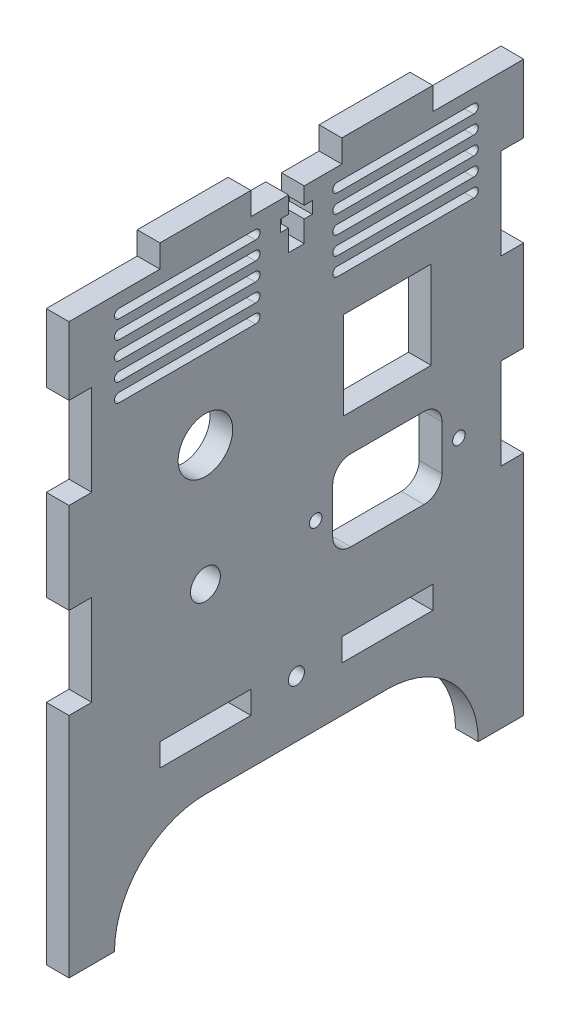
from build123d import *

# Parameters (mm, degrees)
SKETCH1_W                 = 127
SKETCH1_H                 = 165.1
BOSS_EXTRUDE1_DEPTH       = 6.35
SKETCH2_W                 = 25.4
SKETCH2_H                 = 6.35
CUT_EXTRUDE1_DEPTH        = 6.35
LPATTERN1_COUNT           = 3
LPATTERN1_PITCH           = 50.8
CUT_EXTRUDE4_DEPTH        = 6.35
SKETCH8_W                 = 6.35
SKETCH8_H                 = 25.4
CUT_EXTRUDE6_DEPTH        = 6.35
LPATTERN4_COUNT           = 2
LPATTERN4_PITCH           = 50.8
MIRROR1_COPY_1_SKETCH_W   = 6.35
MIRROR1_COPY_1_SKETCH_H   = 25.4
MIRROR1_COPY_1_DEPTH      = 6.35
MIRROR1_COPY_2_SKETCH_W   = 6.35
MIRROR1_COPY_2_SKETCH_H   = 25.4
MIRROR1_COPY_2_DEPTH      = 6.35
SKETCH9_W                 = 25.4
SKETCH9_H                 = 6.35
CUT_EXTRUDE7_DEPTH        = 6.35
LPATTERN6_COUNT           = 2
LPATTERN6_PITCH           = 50.8
SKETCH16_W                = 4.3942
SKETCH16_H                = 13.97
SKETCH16_W_2              = 8.89
SKETCH16_H_2              = 3.302
CUT_EXTRUDE14_DEPTH       = 6.35
F_8_CLEARANCE_HOLE1_D     = 4.4958
F_8_CLEARANCE_HOLE1_DEPTH = 10.16
F_8_CLEARANCE_HOLE1_TIP   = 1.350674586
CUT_EXTRUDE15_DEPTH       = 6.35
LPATTERN7_COPY_1_DEPTH    = 6.35
LPATTERN7_COPY_2_DEPTH    = 6.35
LPATTERN7_COPY_3_DEPTH    = 6.35
LPATTERN7_COPY_4_DEPTH    = 6.35
LPATTERN7_COPY_5_DEPTH    = 6.35
LPATTERN7_COPY_6_DEPTH    = 6.35
LPATTERN7_COPY_7_DEPTH    = 6.35
LPATTERN7_COPY_8_DEPTH    = 6.35
SKETCH20_R                = 1.75
CUT_EXTRUDE16_DEPTH       = 7.62
SKETCH22_W                = 24.5
SKETCH22_H                = 24.5
CUT_EXTRUDE17_DEPTH       = 6.35
SKETCH23_R                = 7.62
CUT_EXTRUDE18_DEPTH       = 7.62
SKETCH24_R                = 4.1671875
CUT_EXTRUDE19_DEPTH       = 7.62


with BuildPart() as part:
    # Sketch1 → Boss-Extrude1 (new body)
    with BuildSketch(Plane(origin=(0, 0, 0), x_dir=(0, 0, -1), z_dir=(1, 0, 0))):
        Rectangle(SKETCH1_W, SKETCH1_H)
    extrude(amount=BOSS_EXTRUDE1_DEPTH)

    # Sketch2 → Cut-Extrude1 (cut)
    with BuildSketch(Plane(origin=(6.35, 0, 0), x_dir=(0, 0, -1), z_dir=(1, 0, 0))):
        with Locations((-50.8, 79.375)):
            Rectangle(SKETCH2_W, SKETCH2_H)
    cut_extrude1 = extrude(amount=-CUT_EXTRUDE1_DEPTH, mode=Mode.SUBTRACT)

    # LPattern1: Cut-Extrude1 ×3
    with Locations(*[(0, 0, -i * LPATTERN1_PITCH) for i in range(1, LPATTERN1_COUNT)]):
        add(cut_extrude1, mode=Mode.SUBTRACT)

    # Sketch5 → Cut-Extrude4 (cut)
    with BuildSketch(Plane(origin=(6.35, 0, 0), x_dir=(0, 0, -1), z_dir=(1, 0, 0))):
        with BuildLine():
            Line((-25.4, -57.15), (25.4, -57.15))
            ThreePointArc((25.4, -57.15), (50.8, -82.55), (25.4, -107.95))
            Line((25.4, -107.95), (-25.4, -107.95))
            ThreePointArc((-25.4, -107.95), (-50.8, -82.55), (-25.4, -57.15))
        make_face()
    extrude(amount=-CUT_EXTRUDE4_DEPTH, mode=Mode.SUBTRACT)

    # Sketch8 → Cut-Extrude6 (cut)
    with BuildSketch(Plane(origin=(6.35, 0, 0), x_dir=(0, 0, -1), z_dir=(1, 0, 0))):
        with Locations((60.325, 44.45)):
            Rectangle(SKETCH8_W, SKETCH8_H)
    cut_extrude6 = extrude(amount=-CUT_EXTRUDE6_DEPTH, mode=Mode.SUBTRACT)

    # LPattern4: Cut-Extrude6 ×2
    with Locations(*[(0, -i * LPATTERN4_PITCH, 0) for i in range(1, LPATTERN4_COUNT)]):
        add(cut_extrude6, mode=Mode.SUBTRACT)

    # Mirror1 copy 1 sketch → Mirror1 copy 1 (cut)
    with BuildSketch(Plane(origin=(6.35, -50.8, 0), x_dir=(0, 0, 1), z_dir=(1, 0, 0))):
        with Locations((60.325, -44.45)):
            Rectangle(MIRROR1_COPY_1_SKETCH_W, MIRROR1_COPY_1_SKETCH_H)
    extrude(amount=-MIRROR1_COPY_1_DEPTH, mode=Mode.SUBTRACT)

    # Mirror1 copy 2 sketch → Mirror1 copy 2 (cut)
    with BuildSketch(Plane(origin=(6.35, 0, 0), x_dir=(0, 0, 1), z_dir=(1, 0, 0))):
        with Locations((60.325, -44.45)):
            Rectangle(MIRROR1_COPY_2_SKETCH_W, MIRROR1_COPY_2_SKETCH_H)
    extrude(amount=-MIRROR1_COPY_2_DEPTH, mode=Mode.SUBTRACT)

    # Sketch9 → Cut-Extrude7 (cut)
    with BuildSketch(Plane.ZY):
        with Locations((-25.4, -41.275)):
            Rectangle(SKETCH9_W, SKETCH9_H)
    cut_extrude7 = extrude(amount=-CUT_EXTRUDE7_DEPTH, mode=Mode.SUBTRACT)

    # LPattern6: Cut-Extrude7 ×2
    with Locations(*[(0, 0, i * LPATTERN6_PITCH) for i in range(1, LPATTERN6_COUNT)]):
        add(cut_extrude7, mode=Mode.SUBTRACT)

    # Sketch16 → Cut-Extrude14 (cut)
    with BuildSketch(Plane.ZY):
        with Locations((0, 69.215)):
            Rectangle(SKETCH16_W, SKETCH16_H)
        with Locations((0, 69.85)):
            Rectangle(SKETCH16_W_2, SKETCH16_H_2)
    extrude(amount=-CUT_EXTRUDE14_DEPTH, mode=Mode.SUBTRACT)

    # #8 Clearance Hole1
    with Locations(Plane.ZY):
        with Locations((0, -41.275)):
            Hole(F_8_CLEARANCE_HOLE1_D / 2, depth=F_8_CLEARANCE_HOLE1_DEPTH)
            with Locations((0, 0, -(F_8_CLEARANCE_HOLE1_DEPTH + F_8_CLEARANCE_HOLE1_TIP / 2))):  # 118° drill point
                Cone(0, F_8_CLEARANCE_HOLE1_D / 2, F_8_CLEARANCE_HOLE1_TIP, mode=Mode.SUBTRACT)

    # Sketch19 → Cut-Extrude15 (cut)
    with BuildSketch(Plane.ZY):
        with BuildLine():
            Line((-49.53, 72.448860523), (-11.43, 72.448860523))
            ThreePointArc((-11.43, 72.448860523), (-10.16, 71.178860523), (-11.43, 69.908860523))
            Line((-11.43, 69.908860523), (-49.53, 69.908860523))
            ThreePointArc((-49.53, 69.908860523), (-50.8, 71.178860523), (-49.53, 72.448860523))
        make_face()
    cut_extrude15 = extrude(amount=-CUT_EXTRUDE15_DEPTH, mode=Mode.SUBTRACT)

    # Mirror2: Cut-Extrude15 across plane
    add(cut_extrude15.mirror(Plane.XY), mode=Mode.SUBTRACT)

    # LPattern7 copy 1 sketch → LPattern7 copy 1 (cut)
    with BuildSketch(Plane(origin=(0, -5.08, 0), x_dir=(0, 0, -1), z_dir=(-1, 0, 0))):
        with BuildLine():
            Line((-49.53, -72.448860523), (-11.43, -72.448860523))
            ThreePointArc((-11.43, -72.448860523), (-10.16, -71.178860523), (-11.43, -69.908860523))
            Line((-11.43, -69.908860523), (-49.53, -69.908860523))
            ThreePointArc((-49.53, -69.908860523), (-50.8, -71.178860523), (-49.53, -72.448860523))
        make_face()
    extrude(amount=-LPATTERN7_COPY_1_DEPTH, mode=Mode.SUBTRACT)

    # LPattern7 copy 2 sketch → LPattern7 copy 2 (cut)
    with BuildSketch(Plane(origin=(0, -10.16, 0), x_dir=(0, 0, -1), z_dir=(-1, 0, 0))):
        with BuildLine():
            Line((-49.53, -72.448860523), (-11.43, -72.448860523))
            ThreePointArc((-11.43, -72.448860523), (-10.16, -71.178860523), (-11.43, -69.908860523))
            Line((-11.43, -69.908860523), (-49.53, -69.908860523))
            ThreePointArc((-49.53, -69.908860523), (-50.8, -71.178860523), (-49.53, -72.448860523))
        make_face()
    extrude(amount=-LPATTERN7_COPY_2_DEPTH, mode=Mode.SUBTRACT)

    # LPattern7 copy 3 sketch → LPattern7 copy 3 (cut)
    with BuildSketch(Plane(origin=(0, -15.24, 0), x_dir=(0, 0, -1), z_dir=(-1, 0, 0))):
        with BuildLine():
            Line((-49.53, -72.448860523), (-11.43, -72.448860523))
            ThreePointArc((-11.43, -72.448860523), (-10.16, -71.178860523), (-11.43, -69.908860523))
            Line((-11.43, -69.908860523), (-49.53, -69.908860523))
            ThreePointArc((-49.53, -69.908860523), (-50.8, -71.178860523), (-49.53, -72.448860523))
        make_face()
    extrude(amount=-LPATTERN7_COPY_3_DEPTH, mode=Mode.SUBTRACT)

    # LPattern7 copy 4 sketch → LPattern7 copy 4 (cut)
    with BuildSketch(Plane(origin=(0, -20.32, 0), x_dir=(0, 0, -1), z_dir=(-1, 0, 0))):
        with BuildLine():
            Line((-49.53, -72.448860523), (-11.43, -72.448860523))
            ThreePointArc((-11.43, -72.448860523), (-10.16, -71.178860523), (-11.43, -69.908860523))
            Line((-11.43, -69.908860523), (-49.53, -69.908860523))
            ThreePointArc((-49.53, -69.908860523), (-50.8, -71.178860523), (-49.53, -72.448860523))
        make_face()
    extrude(amount=-LPATTERN7_COPY_4_DEPTH, mode=Mode.SUBTRACT)

    # LPattern7 copy 5 sketch → LPattern7 copy 5 (cut)
    with BuildSketch(Plane(origin=(0, -5.08, 0), x_dir=(0, 0, 1), z_dir=(-1, 0, 0))):
        with BuildLine():
            Line((-49.53, 72.448860523), (-11.43, 72.448860523))
            ThreePointArc((-11.43, 72.448860523), (-10.16, 71.178860523), (-11.43, 69.908860523))
            Line((-11.43, 69.908860523), (-49.53, 69.908860523))
            ThreePointArc((-49.53, 69.908860523), (-50.8, 71.178860523), (-49.53, 72.448860523))
        make_face()
    extrude(amount=-LPATTERN7_COPY_5_DEPTH, mode=Mode.SUBTRACT)

    # LPattern7 copy 6 sketch → LPattern7 copy 6 (cut)
    with BuildSketch(Plane(origin=(0, -10.16, 0), x_dir=(0, 0, 1), z_dir=(-1, 0, 0))):
        with BuildLine():
            Line((-49.53, 72.448860523), (-11.43, 72.448860523))
            ThreePointArc((-11.43, 72.448860523), (-10.16, 71.178860523), (-11.43, 69.908860523))
            Line((-11.43, 69.908860523), (-49.53, 69.908860523))
            ThreePointArc((-49.53, 69.908860523), (-50.8, 71.178860523), (-49.53, 72.448860523))
        make_face()
    extrude(amount=-LPATTERN7_COPY_6_DEPTH, mode=Mode.SUBTRACT)

    # LPattern7 copy 7 sketch → LPattern7 copy 7 (cut)
    with BuildSketch(Plane(origin=(0, -15.24, 0), x_dir=(0, 0, 1), z_dir=(-1, 0, 0))):
        with BuildLine():
            Line((-49.53, 72.448860523), (-11.43, 72.448860523))
            ThreePointArc((-11.43, 72.448860523), (-10.16, 71.178860523), (-11.43, 69.908860523))
            Line((-11.43, 69.908860523), (-49.53, 69.908860523))
            ThreePointArc((-49.53, 69.908860523), (-50.8, 71.178860523), (-49.53, 72.448860523))
        make_face()
    extrude(amount=-LPATTERN7_COPY_7_DEPTH, mode=Mode.SUBTRACT)

    # LPattern7 copy 8 sketch → LPattern7 copy 8 (cut)
    with BuildSketch(Plane(origin=(0, -20.32, 0), x_dir=(0, 0, 1), z_dir=(-1, 0, 0))):
        with BuildLine():
            Line((-49.53, 72.448860523), (-11.43, 72.448860523))
            ThreePointArc((-11.43, 72.448860523), (-10.16, 71.178860523), (-11.43, 69.908860523))
            Line((-11.43, 69.908860523), (-49.53, 69.908860523))
            ThreePointArc((-49.53, 69.908860523), (-50.8, 71.178860523), (-49.53, 72.448860523))
        make_face()
    extrude(amount=-LPATTERN7_COPY_8_DEPTH, mode=Mode.SUBTRACT)

    # Sketch20 → Cut-Extrude16 (cut)
    with BuildSketch(Plane.ZY):
        with Locations((-45.4, -6.35)):
            Circle(SKETCH20_R)
        with Locations((-5.4, -6.35)):
            Circle(SKETCH20_R)
        with BuildLine():
            Line((-35.65, 4.9), (-15.15, 4.9))
            ThreePointArc((-15.15, 4.9), (-11.614466094, 3.435533906), (-10.15, -0.1))
            Line((-10.15, -0.1), (-10.15, -12.6))
            ThreePointArc((-10.15, -12.6), (-11.614466094, -16.135533906), (-15.15, -17.6))
            Line((-15.15, -17.6), (-35.65, -17.6))
            ThreePointArc((-35.65, -17.6), (-39.185533906, -16.135533906), (-40.65, -12.6))
            Line((-40.65, -12.6), (-40.65, -0.1))
            ThreePointArc((-40.65, -0.1), (-39.185533906, 3.435533906), (-35.65, 4.9))
        make_face()
    extrude(amount=-CUT_EXTRUDE16_DEPTH, mode=Mode.SUBTRACT)

    # Sketch22 → Cut-Extrude17 (cut)
    with BuildSketch(Plane.ZY):
        with Locations((-25.4, 27.31)):
            Rectangle(SKETCH22_W, SKETCH22_H)
    extrude(amount=-CUT_EXTRUDE17_DEPTH, mode=Mode.SUBTRACT)

    # Sketch23 → Cut-Extrude18 (cut)
    with BuildSketch(Plane.ZY):
        with Locations((25.4, 27.31)):
            Circle(SKETCH23_R)
    extrude(amount=-CUT_EXTRUDE18_DEPTH, mode=Mode.SUBTRACT)

    # Sketch24 → Cut-Extrude19 (cut)
    with BuildSketch(Plane.ZY):
        with Locations((25.4, -6.35)):
            Circle(SKETCH24_R)
    extrude(amount=-CUT_EXTRUDE19_DEPTH, mode=Mode.SUBTRACT)


solid = part.part
